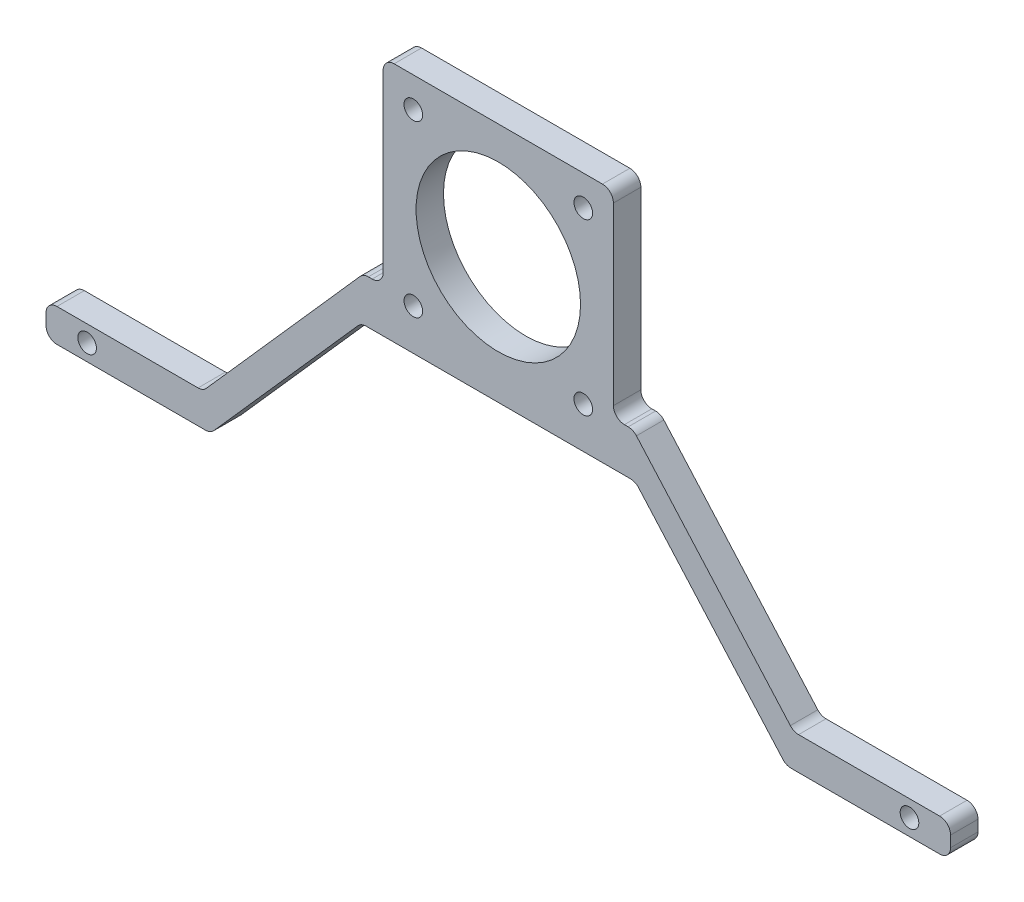
from build123d import *

# Parameters (mm, degrees)
EXTRUDE_1_DEPTH            = 5
FILLET_1_R                 = 2
HOLE_WIZARD_M3_1_OUTLINE_R = 1.7
HOLE_WIZARD_M3_1_DEPTH     = 5
SKETCH_4_R                 = 15
CUT_EXTRUDE_1_DEPTH        = 10
HOLE_WIZARD_M3_5_D         = 3.4


# Read off the part's stored shape, not the designer's step: M3 间隙孔1
with BuildPart() as part:
    # 草图1 → 凸台-拉伸1 (new body)
    with BuildSketch(Plane.XY):
        Polygon((30, 0), (57.5, 31.083095625), (107.5, 31.083095625), (135, 0), (165, 0), (165, 6), (136.367610504, 6), (107.098159975, 39.083095625), (103.5, 39.083095625), (103.5, 75.083095625), (61.5, 75.083095625), (61.5, 39.083095625), (57.901840025, 39.083095625), (28.632389496, 6), (0, 6), (0, 0), align=None)
    extrude(amount=EXTRUDE_1_DEPTH)

    # 圆角1
    fillet_1_edges = [part.edges().sort_by_distance(p)[0] for p in [
        (28.632389496, 6, 2.5),
        (0, 6, 2.5),
        (0, 0, 2.5),
        (30, 0, 2.5),
        (57.5, 31.083095625, 2.5),
        (107.5, 31.083095625, 2.5),
        (135, 0, 2.5),
        (165, 0, 2.5),
        (165, 6, 2.5),
        (136.367610504, 6, 2.5),
        (107.098159975, 39.083095625, 2.5),
        (103.5, 39.083095625, 2.5),
        (103.5, 75.083095625, 2.5),
        (61.5, 75.083095625, 2.5),
        (61.5, 39.083095625, 2.5),
        (57.901840025, 39.083095625, 2.5),
    ]]
    fillet(fillet_1_edges, radius=FILLET_1_R)

    # M3 间隙孔1 outline → M3 间隙孔1 (cut)
    with BuildSketch(Plane.XY):
        with Locations((98, 69.583095625)):
            Circle(HOLE_WIZARD_M3_1_OUTLINE_R)
        with Locations((67, 38.583095625)):
            Circle(HOLE_WIZARD_M3_1_OUTLINE_R)
        with Locations((98, 38.583095625)):
            Circle(HOLE_WIZARD_M3_1_OUTLINE_R)
        with Locations((67, 69.583095625)):
            Circle(HOLE_WIZARD_M3_1_OUTLINE_R)
    extrude(amount=HOLE_WIZARD_M3_1_DEPTH, mode=Mode.SUBTRACT)

    # 草图4 → 切除-拉伸1 (cut)
    with BuildSketch(Plane.XY.offset(5)):
        with Locations((82.5, 54.083095625)):
            Circle(SKETCH_4_R)
    extrude(amount=-CUT_EXTRUDE_1_DEPTH, mode=Mode.SUBTRACT)

    # M3 间隙孔5 (through all)
    with Locations(Plane.XY.offset(5)):
        with Locations((7.5, 3), (157.5, 3)):
            Hole(HOLE_WIZARD_M3_5_D / 2)


solid = part.part
